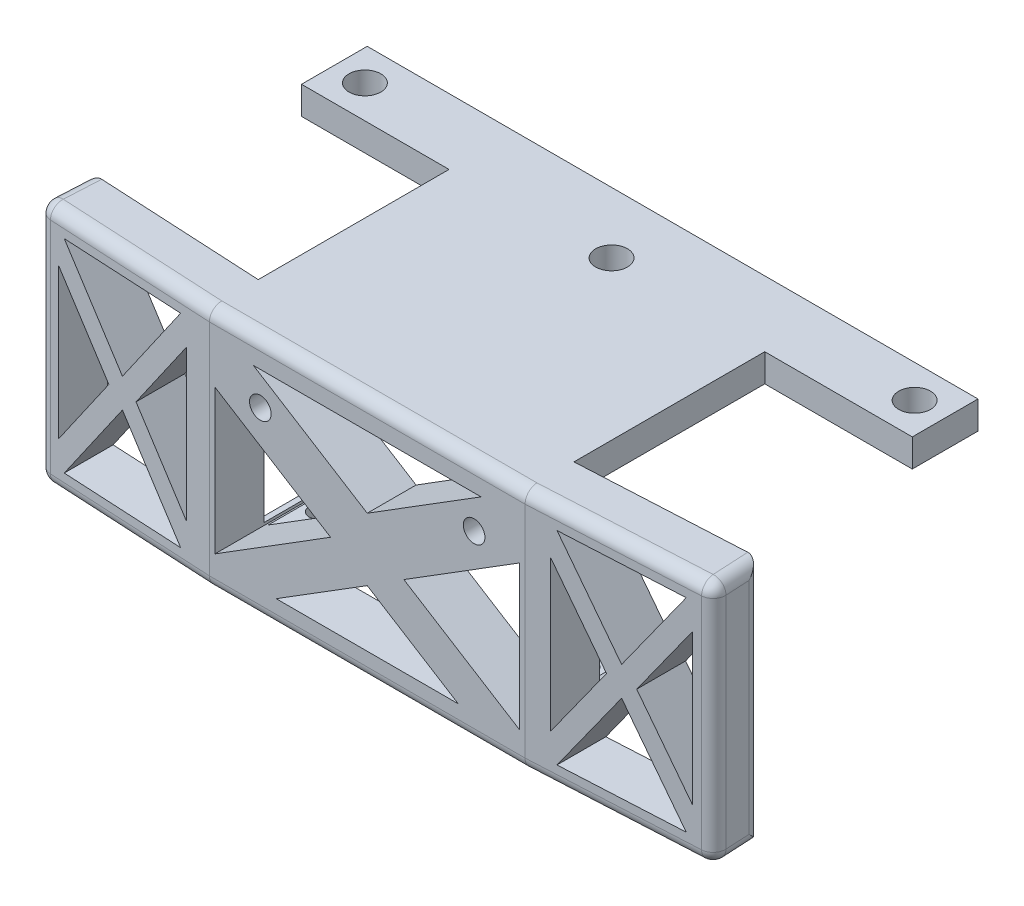
from build123d import *

# Parameters (mm, degrees)
SKETCH1_W                = 51.691952551
SKETCH1_H                = 12
SKETCH1_R                = 1.5
BOSS_EXTRUDE1_DEPTH      = 6
SKETCH2_W                = 51.691952551
SKETCH2_H                = 35
SKETCH2_R                = 1.770138793
BOSS_EXTRUDE2_DEPTH      = 8
SKETCH3_R                = 2.25
CUT_EXTRUDE1_DEPTH       = 2
SKETCH4_R                = 2.25
CUT_EXTRUDE2_DEPTH       = 2
BOSS_EXTRUDE3_DEPTH      = 5
BOSS_EXTRUDE3_DEPTH_BACK = 0.0001
SKETCH5_W                = 24.154023724
SKETCH5_H                = 10.75880516
SKETCH5_W_2              = 24.154023725
CUT_EXTRUDE5_DEPTH       = 54
SKETCH15_W               = 33.389515724
SKETCH15_H               = 11.934964058
SKETCH15_W_2             = 15.051094337
SKETCH15_H_2             = 8.223566484
CUT_EXTRUDE6_DEPTH       = 31
BOSS_EXTRUDE6_REACH      = 97.481
CUT_EXTRUDE8_DEPTH       = 31
FILLET1_R                = 2
SKETCH23_R               = 2.6
CUT_EXTRUDE9_DEPTH       = 31
SKETCH25_W               = 109.4362768
SKETCH25_H               = 39.504770738
SKETCH25_W_2             = 51.691952551
SKETCH25_H_2             = 2.495229262
CUT_EXTRUDE10_DEPTH      = 0.437959608


with BuildPart() as part:
    # Sketch1 → Boss-Extrude1 (new body)
    with BuildSketch(Plane(origin=(0, 0, 0), x_dir=(1, 0, 0), z_dir=(0, 1, 0))):
        with Locations((25.845976275, 6)):
            Rectangle(SKETCH1_W, SKETCH1_H)
        with Locations(Location((3.845976276, 6, 0), (0, 0, 270))):
            Circle(SKETCH1_R, mode=Mode.SUBTRACT)
        with Locations(Location((47.845976276, 6, 0), (0, 0, 90))):
            Circle(SKETCH1_R, mode=Mode.SUBTRACT)
    extrude(amount=BOSS_EXTRUDE1_DEPTH)

    # Sketch2 → Boss-Extrude2 (add)
    with BuildSketch(Plane.XY):
        with Locations((25.845976275, 17.5)):
            Rectangle(SKETCH2_W, SKETCH2_H)
        with Locations((8.345976276, 30)):
            Circle(SKETCH2_R, mode=Mode.SUBTRACT)
        with Locations(Location((43.345976276, 30, 0), (0, 0, 180))):
            Circle(SKETCH2_R, mode=Mode.SUBTRACT)
    extrude(amount=BOSS_EXTRUDE2_DEPTH)

    # Sketch3 → Cut-Extrude1 (cut)
    with BuildSketch(Plane.XZ):
        with Locations(Location((47.845976276, -6, 0), (0, 0, 270))):
            Circle(SKETCH3_R)
        with Locations(Location((3.845976276, -6, 0), (0, 0, 270))):
            Circle(SKETCH3_R)
    extrude(amount=-CUT_EXTRUDE1_DEPTH, mode=Mode.SUBTRACT)

    # Sketch4 → Cut-Extrude2 (cut)
    with BuildSketch(Plane(origin=(0, 0, 0), x_dir=(-1, 0, 0), z_dir=(0, 0, -1))):
        with Locations((-43.345976276, 30)):
            Circle(SKETCH4_R)
        with Locations((-8.345976276, 30)):
            Circle(SKETCH4_R)
    extrude(amount=-CUT_EXTRUDE2_DEPTH, mode=Mode.SUBTRACT)

    # Sketch5 → Boss-Extrude3 (add, two sides: drawn at the far end of the back side and taken through both)
    # profile 1 of 3: a face of its own
    with BuildSketch(Plane(origin=(0, 35, 0), x_dir=(1, 0, 0), z_dir=(0, 1, 0)).offset(-BOSS_EXTRUDE3_DEPTH_BACK)):
        Polygon((0, -8), (25.845976276, -8), (51.691952551, -8), (51.691952551, 31.24119484), (51.691952551, 42), (0, 42), (0, 31.24119484), align=None)
        with BuildLine():
            ThreePointArc((28.345976276, 32), (27.613743229, 30.232233047), (25.845976276, 29.5))
            ThreePointArc((25.845976276, 29.5), (24.078209323, 33.767766953), (28.345976276, 32))
        make_face(mode=Mode.SUBTRACT)
    # profile 2 of 3: a face of its own
    with BuildSketch(Plane(origin=(0, 35, 0), x_dir=(1, 0, 0), z_dir=(0, 1, 0)).offset(-BOSS_EXTRUDE3_DEPTH_BACK)):
        with Locations((-12.077011862, 36.62059742)):
            Rectangle(SKETCH5_W, SKETCH5_H)
    # profile 3 of 3: a face of its own
    with BuildSketch(Plane(origin=(0, 35, 0), x_dir=(1, 0, 0), z_dir=(0, 1, 0)).offset(-BOSS_EXTRUDE3_DEPTH_BACK)):
        with Locations((63.768964414, 36.62059742)):
            Rectangle(SKETCH5_W_2, SKETCH5_H)
    extrude(amount=BOSS_EXTRUDE3_DEPTH + BOSS_EXTRUDE3_DEPTH_BACK)

    # Sketch14 → Cut-Extrude5 (cut)
    with BuildSketch(Plane.XY.offset(8)):
        Polygon((50.775139706, 29.207985595), (50.775139706, 5.569526874), (31.845976276, 17.388756234), align=None)
        Polygon((19.845976276, 17.388756234), (0.916812846, 5.569526874), (0.916812846, 29.207985595), align=None)
        Polygon((25.845976276, 23.799215747), (44.485921829, 35.437859608), (7.206030723, 35.437859608), align=None)
        Polygon((25.845976276, 13.532490719), (10.943267581, 4.227349855), (40.74868497, 4.227349855), align=None)
    extrude(amount=-CUT_EXTRUDE5_DEPTH, mode=Mode.SUBTRACT)

    # Sketch15 → Cut-Extrude6 (cut)
    with BuildSketch(Plane.XZ):
        with Locations((26.834743107, -6.032517971)):
            Rectangle(SKETCH15_W, SKETCH15_H)
        with Locations((26.283455375, -16.111783242)):
            Rectangle(SKETCH15_W_2, SKETCH15_H_2)
    extrude(amount=-CUT_EXTRUDE6_DEPTH, mode=Mode.SUBTRACT)

    # Boss-Extrude6: up to this face of the body (flat: up to its plane)
    boss_extrude6_end = Plane(part.part.faces().sort_by_distance((25.193104525, 0, 0.873444785))[0])
    # Sketch20 → Boss-Extrude6 (add, up to the picked face)
    with BuildSketch(Plane(origin=(0, 40, 0), x_dir=(1, 0, 0), z_dir=(0, 1, 0)), mode=Mode.PRIVATE) as boss_extrude6_sk1:
        Polygon((0, -8), (-29.456928706, -6.456227782), (-29.038814853, 1.521859799), (0, 0), align=None)
    boss_extrude6_tool1 = split(extrude(boss_extrude6_sk1.sketch, amount=-BOSS_EXTRUDE6_REACH, mode=Mode.PRIVATE), bisect_by=boss_extrude6_end, keep=Keep.BOTH, mode=Mode.PRIVATE)
    # Sketch20 → Boss-Extrude6 (add, up to the picked face)
    with BuildSketch(Plane(origin=(0, 40, 0), x_dir=(1, 0, 0), z_dir=(0, 1, 0)), mode=Mode.PRIVATE) as boss_extrude6_sk2:
        Polygon((51.691952551, 0), (51.691952551, -8), (81.148881258, -6.456227782), (80.730767404, 1.521859799), align=None)
    boss_extrude6_tool2 = split(extrude(boss_extrude6_sk2.sketch, amount=-BOSS_EXTRUDE6_REACH, mode=Mode.PRIVATE), bisect_by=boss_extrude6_end, keep=Keep.BOTH, mode=Mode.PRIVATE)
    add(boss_extrude6_tool1.solids().sort_by(Axis((-14.624185, 40, 3.243109), (0, -1, 0)))[0])
    add(boss_extrude6_tool2.solids().sort_by(Axis((66.316137, 40, 3.243109), (0, -1, 0)))[0])

    # Sketch21 → Cut-Extrude8 (cut)
    with BuildSketch(Plane.XY.offset(8)):
        Polygon((-3.96613305, 7.67862469), (-3.96613305, 32.32137531), (-12.669640792, 20), align=None)
        Polygon((-4.965773008, 36.621958218), (-15.018260668, 22.39086003), (-25.070748328, 36.621958218), align=None)
        Polygon((-15.018260668, 17.60913997), (-25.070748328, 3.378041782), (-4.965773008, 3.378041782), align=None)
        Polygon((-26.070388286, 32.32137531), (-17.366880544, 20), (-26.070388286, 7.67862469), align=None)
        Polygon((69.058833096, 20), (77.762340838, 7.67862469), (77.762340838, 32.32137531), align=None)
        Polygon((76.762700879, 3.378041782), (56.657725559, 3.378041782), (66.710213219, 17.60913997), align=None)
        Polygon((76.762700879, 36.621958218), (56.657725559, 36.621958218), (66.710213219, 22.39086003), align=None)
        Polygon((64.361593343, 20), (55.658085601, 7.67862469), (55.658085601, 32.32137531), align=None)
    extrude(amount=-CUT_EXTRUDE8_DEPTH, mode=Mode.SUBTRACT)

    # Fillet1
    # the kernel refuses this fillet: 2 mm, written as the material it takes off along each edge
    with BuildSketch(Plane(origin=(-27.354997724, 38, 4.563640625), x_dir=(-0.9986295347545743, 0, -0.05233595624293728), z_dir=(0, 1, 0))) as fillet1_piece_1_section:
        Polygon((0, 0), (FILLET1_R, 0), (FILLET1_R, FILLET1_R), (0, FILLET1_R), align=None)
    fillet1_piece_1 = extrude(amount=FILLET1_R, mode=Mode.PRIVATE)
    fillet1_piece_1 = fillet1_piece_1 - Plane(origin=(-27.354997724, 38, 4.563640625), x_dir=(0.7431448254773897, 0, -0.6691306063588632), z_dir=(0, 1, 0)) * Sphere(FILLET1_R, mode=Mode.PRIVATE)
    add(fillet1_piece_1, mode=Mode.SUBTRACT)
    with BuildSketch(Plane(origin=(-27.354997724, 2, 4.563640625), x_dir=(-0.9986295347545743, 0, -0.05233595624293728), z_dir=(0, -1, 0))) as fillet1_piece_2_section:
        Polygon((0, 0), (FILLET1_R, 0), (FILLET1_R, -FILLET1_R), (0, -FILLET1_R), align=None)
    fillet1_piece_2 = extrude(amount=FILLET1_R, mode=Mode.PRIVATE)
    fillet1_piece_2 = fillet1_piece_2 - Plane(origin=(-27.354997724, 2, 4.563640625), x_dir=(0.7431448254773897, 0, -0.6691306063588632), z_dir=(0, -1, 0)) * Sphere(FILLET1_R, mode=Mode.PRIVATE)
    add(fillet1_piece_2, mode=Mode.SUBTRACT)
    with BuildSketch(Plane(origin=(79.046950276, 38, 4.563640625), x_dir=(0, 1, 0), z_dir=(0.052335956242936896, 0, 0.9986295347545743))) as fillet1_piece_3_section:
        Polygon((0, 0), (FILLET1_R, 0), (FILLET1_R, -FILLET1_R), (0, -FILLET1_R), align=None)
    fillet1_piece_3 = extrude(amount=FILLET1_R, mode=Mode.PRIVATE)
    fillet1_piece_3 = fillet1_piece_3 - Plane(origin=(79.046950276, 38, 4.563640625), x_dir=(-0.7061377159181265, -0.7071067811865475, 0.03700710955926369), z_dir=(0.052335956242936896, 0, 0.9986295347545743)) * Sphere(FILLET1_R, mode=Mode.PRIVATE)
    add(fillet1_piece_3, mode=Mode.SUBTRACT)
    with BuildSketch(Plane(origin=(79.046950276, 2, 4.563640625), x_dir=(0.9986295347545743, 0, -0.05233595624293772), z_dir=(0.052335956242936896, 0, 0.9986295347545743))) as fillet1_piece_4_section:
        Polygon((0, 0), (FILLET1_R, 0), (FILLET1_R, -FILLET1_R), (0, -FILLET1_R), align=None)
    fillet1_piece_4 = extrude(amount=FILLET1_R, mode=Mode.PRIVATE)
    fillet1_piece_4 = fillet1_piece_4 - Plane(origin=(79.046950276, 2, 4.563640625), x_dir=(-0.7061377159181265, 0.7071067811865475, 0.03700710955926369), z_dir=(0.052335956242936896, 0, 0.9986295347545743)) * Sphere(FILLET1_R, mode=Mode.PRIVATE)
    add(fillet1_piece_4, mode=Mode.SUBTRACT)
    with BuildSketch(Plane(origin=(-29.352256794, 40, 4.458968713), x_dir=(0.9986295347545742, 0, 0.052335956242937264), z_dir=(0.05233595624293728, 0, -0.9986295347545743)), Plane(origin=(81.044209345, 0, 4.458968713), x_dir=(-0.9986295347545742, 1.7763568394002568e-15, 0.052335956242937715), z_dir=(-0.05233595624293772, 0, -0.9986295347545743))) as fillet1_piece_5:
        with BuildLine():
            CenterArc((FILLET1_R, FILLET1_R), FILLET1_R, 180, 90)
            Line((0, FILLET1_R), (0, 0))
            Line((0, 0), (FILLET1_R, 0))
        make_face()
    extrude(amount=10.989036278, mode=Mode.SUBTRACT)
    with BuildSketch(Plane(origin=(4.993147674, 40, 8.261679781), x_dir=(0.05233595624293691, 0, -0.9986295347545743), z_dir=(-0.9986295347545743, 0, -0.05233595624293691)), Plane(origin=(46.698804878, 0, 8.261679781), x_dir=(-0.052335956242936896, 0, -0.9986295347545743), z_dir=(0.9986295347545743, 0, -0.052335956242936896))) as fillet1_piece_6:
        with BuildLine():
            CenterArc((FILLET1_R, FILLET1_R), FILLET1_R, 180, 90)
            Line((0, FILLET1_R), (0, 0))
            Line((0, 0), (FILLET1_R, 0))
        make_face()
    extrude(amount=32.497353804, mode=Mode.SUBTRACT)
    with BuildSketch(Plane(origin=(-29.038814853, 45, -1.521859799), x_dir=(0.9986295347545744, 0, 0.05233595624293688), z_dir=(0, -1, 0))) as fillet1_piece_7:
        with BuildLine():
            CenterArc((FILLET1_R, FILLET1_R), FILLET1_R, 180, 90)
            Line((0, FILLET1_R), (0, 0))
            Line((0, 0), (FILLET1_R, 0))
        make_face()
    extrude(amount=50, mode=Mode.SUBTRACT)
    with BuildSketch(Plane(origin=(-29.352256794, 0, 4.458968713), x_dir=(0.9986295347545744, 0, 0.05233595624293728), z_dir=(0.05233595624293728, 0, -0.9986295347545743)), Plane(origin=(81.044209345, 40, 4.458968713), x_dir=(-0.9986295347545742, 0, 0.052335956242937715), z_dir=(-0.05233595624293772, 0, -0.9986295347545743))) as fillet1_piece_8:
        with BuildLine():
            CenterArc((FILLET1_R, -FILLET1_R), FILLET1_R, 90, 90)
            Line((0, -FILLET1_R), (0, 0))
            Line((0, 0), (FILLET1_R, 0))
        make_face()
    extrude(amount=10.989036278, mode=Mode.SUBTRACT)
    with BuildSketch(Plane(origin=(-29.456928706, 38, 6.456227782), x_dir=(0.0523359562429366, 0, -0.9986295347545744), z_dir=(0, -1, 0))) as fillet1_piece_9:
        with BuildLine():
            CenterArc((FILLET1_R, FILLET1_R), FILLET1_R, 180, 90)
            Line((0, FILLET1_R), (0, 0))
            Line((0, 0), (FILLET1_R, 0))
        make_face()
    extrude(amount=36, mode=Mode.SUBTRACT)
    with BuildSketch(Plane(origin=(4.993147674, 0, 8.261679781), x_dir=(0.05233595624293691, 0, -0.9986295347545743), z_dir=(-0.9986295347545743, 0, -0.05233595624293691)), Plane(origin=(46.698804878, 40, 8.261679781), x_dir=(-0.052335956242936896, 0, -0.9986295347545743), z_dir=(0.9986295347545743, 0, -0.052335956242936896))) as fillet1_piece_10:
        with BuildLine():
            CenterArc((FILLET1_R, -FILLET1_R), FILLET1_R, 90, 90)
            Line((0, -FILLET1_R), (0, 0))
            Line((0, 0), (FILLET1_R, 0))
        make_face()
    extrude(amount=32.497353804, mode=Mode.SUBTRACT)
    with BuildSketch(Plane(origin=(-5, 0, 8), x_dir=(0, 0, -1), z_dir=(1, 0, 0)), Plane(origin=(56.691952551, 40, 8), x_dir=(0, 0, -1), z_dir=(-1, 0, 0))) as fillet1_piece_11:
        with BuildLine():
            CenterArc((FILLET1_R, FILLET1_R), FILLET1_R, 180, 90)
            Line((0, FILLET1_R), (0, 0))
            Line((0, 0), (FILLET1_R, 0))
        make_face()
    extrude(amount=61.691952551, mode=Mode.SUBTRACT)
    with BuildSketch(Plane(origin=(81.148881258, 38, 6.456227782), x_dir=(-0.05233595624293482, 0, -0.9986295347545744), z_dir=(0, -1, 0))) as fillet1_piece_12:
        with BuildLine():
            CenterArc((FILLET1_R, -FILLET1_R), FILLET1_R, 90, 90)
            Line((0, -FILLET1_R), (0, 0))
            Line((0, 0), (FILLET1_R, 0))
        make_face()
    extrude(amount=36, mode=Mode.SUBTRACT)
    with BuildSketch(Plane(origin=(80.730767404, 45, -1.521859799), x_dir=(-0.9986295347545743, 0, 0.052335956242936604), z_dir=(0, -1, 0))) as fillet1_piece_13:
        with BuildLine():
            CenterArc((FILLET1_R, -FILLET1_R), FILLET1_R, 90, 90)
            Line((0, -FILLET1_R), (0, 0))
            Line((0, 0), (FILLET1_R, 0))
        make_face()
    extrude(amount=50, mode=Mode.SUBTRACT)

    # Sketch23 → Cut-Extrude9 (cut)
    with BuildSketch(Plane(origin=(0, 40, 0), x_dir=(1, 0, 0), z_dir=(0, 1, 0))):
        with Locations(Location((-19.154023724, 36.62059742, 0), (0, 0, 270))):
            Circle(SKETCH23_R)
        with Locations(Location((25.845976276, 32, 0), (0, 0, 270))):
            Circle(SKETCH23_R)
        with Locations(Location((70.845976276, 36.62059742, 0), (0, 0, 270))):
            Circle(SKETCH23_R)
    extrude(amount=-CUT_EXTRUDE9_DEPTH, mode=Mode.SUBTRACT)

    # Sketch25 → Cut-Extrude10 (cut)
    with BuildSketch(Plane.XZ.offset(-34.9999)):
        with Locations((30.564114676, -22.247614631)):
            Rectangle(SKETCH25_W, SKETCH25_H)
        with Locations((25.845976275, -1.247614631)):
            Rectangle(SKETCH25_W_2, SKETCH25_H_2)
    extrude(amount=-CUT_EXTRUDE10_DEPTH, mode=Mode.SUBTRACT)


solid = part.part
